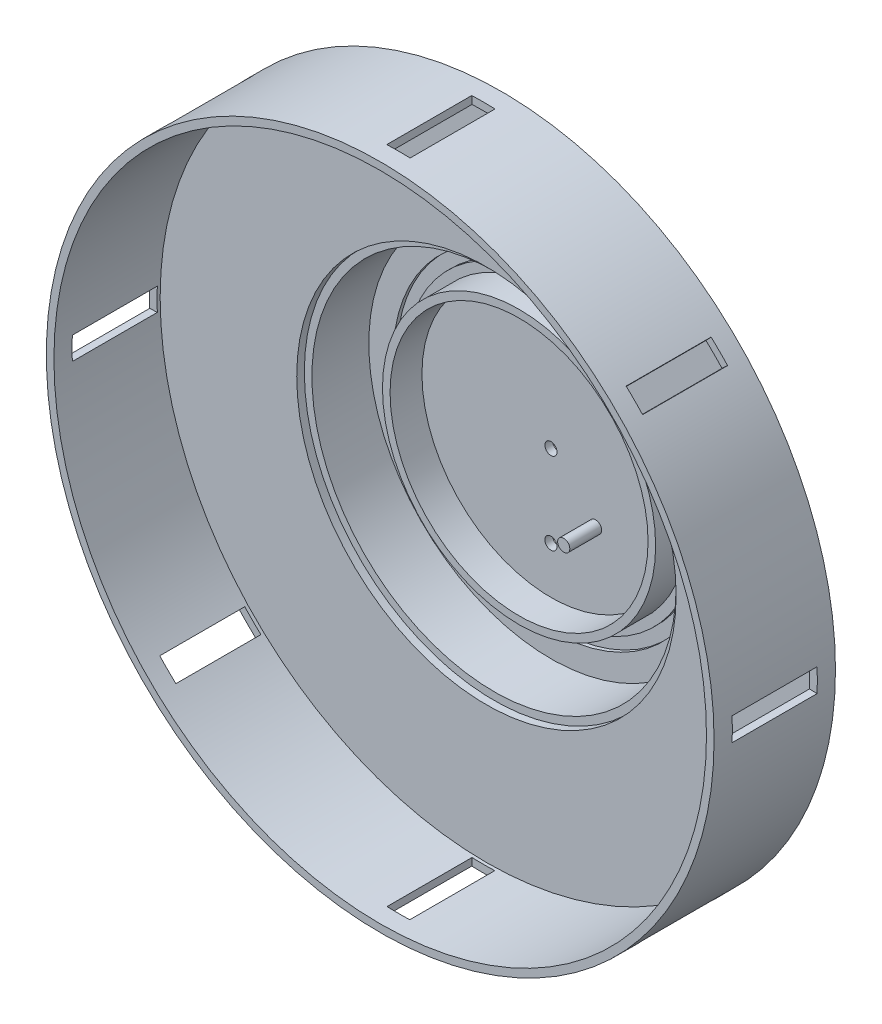
from build123d import *

# Parameters (mm, degrees)
BOSS_EXTRUDE1_DEPTH      = 1.25
BOSS_EXTRUDE1_DEPTH_BACK = 1.25
SKETCH1_R                = 60
SKETCH1_R_2              = 45
SKETCH1_R_3              = 42.5
SKETCH1_R_4              = 2
SKETCH1_3_R              = 45
SKETCH1_3_R_2            = 42.5
SKETCH1_3_R_3            = 2
BOSS_EXTRUDE2_DEPTH      = 11.75
BOSS_EXTRUDE3_DEPTH      = 20
BOSS_EXTRUDE3_DEPTH_BACK = 1.25
SKETCH1_4_R              = 62.5
SKETCH1_4_R_2            = 60
BOSS_EXTRUDE4_START      = -1.25
BOSS_EXTRUDE4_DEPTH      = 1.25
BOSS_EXTRUDE5_DEPTH      = 2.5
BOSS_EXTRUDE5_DEPTH_BACK = 2.5
SKETCH2_R                = 110
SKETCH2_R_2              = 107.5
SKETCH2_R_3              = 62.5
SKETCH3_R                = 110
SKETCH3_R_2              = 107.5
BOSS_EXTRUDE6_DEPTH      = 35
BOSS_EXTRUDE7_START      = 10
SKETCH5_R                = 60
SKETCH5_R_2              = 48
BOSS_EXTRUDE7_DEPTH      = 10
CUT_EXTRUDE1_DEPTH       = 167.287589735
FILLET1_R                = 1
CIRPATTERN2_COUNT        = 8
FILLET1_OF_CIRPATTERN2_R = 1
SKETCH7_R                = 57.5
CUT_EXTRUDE2_DEPTH       = 2.5
CUT_REVOLVE1_START       = 23.5
CUT_REVOLVE1_DEPTH       = 28
CIRPATTERN3_COUNT        = 8


# Read off the part's stored shape, not the designer's step: Cut-Revolve1
with BuildPart() as part:
    # Sketch1 → Boss-Extrude1 (new, two sides: drawn at the far end of the back side and taken through both)
    # profile 1 of 4: a face of its own
    with BuildSketch(Plane.XY.offset(-BOSS_EXTRUDE1_DEPTH_BACK)):
        Circle(SKETCH1_R)
        Circle(SKETCH1_R_2, mode=Mode.SUBTRACT)
        with BuildLine():
            ThreePointArc((-45.033320997, -26), (-42.301270189, -26.732050808), (-41.569219382, -24))
            ThreePointArc((-41.569219382, -24), (-46.364439662, 12.423314165), (-24, 41.569219382))
            ThreePointArc((-24, 41.569219382), (-23.267949192, 44.301270189), (-26, 45.033320997))
            ThreePointArc((-26, 45.033320997), (-50.228142967, 13.458590345), (-45.033320997, -26))
        make_face(mode=Mode.SUBTRACT)
        with BuildLine():
            ThreePointArc((45.033320997, -26), (44.301270189, -23.267949192), (41.569219382, -24))
            ThreePointArc((41.569219382, -24), (12.423314165, -46.364439662), (-24, -41.569219382))
            ThreePointArc((-24, -41.569219382), (-26.732050808, -42.301270189), (-26, -45.033320997))
            ThreePointArc((-26, -45.033320997), (13.458590345, -50.228142967), (45.033320997, -26))
        make_face(mode=Mode.SUBTRACT)
        with BuildLine():
            ThreePointArc((0, 52), (-2, 50), (0, 48))
            ThreePointArc((0, 48), (33.941125497, 33.941125497), (48, 0))
            ThreePointArc((48, 0), (50, -2), (52, 0))
            ThreePointArc((52, 0), (36.769552622, 36.769552622), (0, 52))
        make_face(mode=Mode.SUBTRACT)
    # profile 2 of 4: a face of its own
    with BuildSketch(Plane.XY.offset(-BOSS_EXTRUDE1_DEPTH_BACK)):
        Circle(SKETCH1_R_2)
        Circle(SKETCH1_R_3, mode=Mode.SUBTRACT)
    # profile 3 of 4: a face of its own
    with BuildSketch(Plane.XY.offset(-BOSS_EXTRUDE1_DEPTH_BACK)):
        Circle(SKETCH1_R_3)
        Circle(SKETCH1_R_4, mode=Mode.SUBTRACT)
        with Locations((14.715815051, -14.981481481)):
            Circle(SKETCH1_R_4, mode=Mode.SUBTRACT)
        with Locations((0, -27)):
            Circle(SKETCH1_R_4, mode=Mode.SUBTRACT)
    # profile 4 of 4: a face of its own
    with BuildSketch(Plane.XY.offset(-BOSS_EXTRUDE1_DEPTH_BACK)):
        with Locations((14.715815051, -14.981481481)):
            Circle(SKETCH1_R_4)
    extrude(amount=BOSS_EXTRUDE1_DEPTH + BOSS_EXTRUDE1_DEPTH_BACK)

    # Sketch1<3> → Boss-Extrude2 (add)
    # profile 1 of 2: a face of its own
    with BuildSketch(Plane.XY):
        Circle(SKETCH1_3_R)
        Circle(SKETCH1_3_R_2, mode=Mode.SUBTRACT)
    # profile 2 of 2: a face of its own
    with BuildSketch(Plane.XY):
        with Locations((14.715815051, -14.981481481)):
            Circle(SKETCH1_3_R_3)
    extrude(amount=BOSS_EXTRUDE2_DEPTH)

    # Sketch1<4> → Boss-Extrude3 (add, two sides: drawn at the far end of the back side and taken through both)
    with BuildSketch(Plane.XY.offset(-BOSS_EXTRUDE3_DEPTH_BACK)):
        Circle(SKETCH1_4_R)
        Circle(SKETCH1_4_R_2, mode=Mode.SUBTRACT)
    extrude(amount=BOSS_EXTRUDE3_DEPTH + BOSS_EXTRUDE3_DEPTH_BACK)

    # Sketch1<5> → Boss-Extrude4 (add)
    with BuildSketch(Plane.XY.offset(BOSS_EXTRUDE4_START)):
        with BuildLine():
            ThreePointArc((52, 0), (36.769552622, 36.769552622), (0, 52))
            ThreePointArc((0, 52), (-2, 50), (0, 48))
            ThreePointArc((0, 48), (33.941125497, 33.941125497), (48, 0))
            ThreePointArc((48, 0), (50, -2), (52, 0))
        make_face()
        with BuildLine():
            ThreePointArc((-26, 45.033320997), (-50.228142967, 13.458590345), (-45.033320997, -26))
            ThreePointArc((-45.033320997, -26), (-42.301270189, -26.732050808), (-41.569219382, -24))
            ThreePointArc((-41.569219382, -24), (-46.364439662, 12.423314165), (-24, 41.569219382))
            ThreePointArc((-24, 41.569219382), (-23.267949192, 44.301270189), (-26, 45.033320997))
        make_face()
        with BuildLine():
            ThreePointArc((-26, -45.033320997), (13.458590345, -50.228142967), (45.033320997, -26))
            ThreePointArc((45.033320997, -26), (44.301270189, -23.267949192), (41.569219382, -24))
            ThreePointArc((41.569219382, -24), (12.423314165, -46.364439662), (-24, -41.569219382))
            ThreePointArc((-24, -41.569219382), (-26.732050808, -42.301270189), (-26, -45.033320997))
        make_face()
    extrude(amount=BOSS_EXTRUDE4_DEPTH)

    # Sketch5 → Boss-Extrude7 (add)
    with BuildSketch(Plane(origin=(0, 0, -1.25), x_dir=(-1, 0, 0), z_dir=(0, 0, -1)).offset(BOSS_EXTRUDE7_START)):
        with Locations(Location((0, 0, 0), (0, 0, 180))):
            Circle(SKETCH5_R)
        Circle(SKETCH5_R_2, mode=Mode.SUBTRACT)
    extrude(amount=-BOSS_EXTRUDE7_DEPTH)

    # Sketch6 → Cut-Extrude1 (cut, through all)
    with BuildSketch(Plane(origin=(0, 0, -1.25), x_dir=(-1, 0, 0), z_dir=(0, 0, -1))):
        with BuildLine():
            Line((-48, 0), (-51.5, 0))
            ThreePointArc((-51.5, 0), (-52.173802074, 8.001391261), (-50.568057014, 15.868910193))
            Line((-50.568057014, 15.868910193), (-45.778413636, 14.433878376))
            ThreePointArc((-45.778413636, 14.433878376), (-47.441352502, 7.301922537), (-48, 0))
        make_face()
    cut_extrude1 = extrude(amount=CUT_EXTRUDE1_DEPTH, mode=Mode.SUBTRACT)

    # Fillet1
    fillet1_edges = [part.edges().sort_by_distance(p)[0] for p in [
        (50.568057014, 15.868910193, -6.25),
        (51.5, 0, -6.25),
    ]]
    fillet(fillet1_edges, radius=FILLET1_R)

    # CirPattern2: Cut-Extrude1 ×8 about axis
    cirpattern2_axis = Axis((0, 0, 0), (0, 0, 1))
    for i in range(1, CIRPATTERN2_COUNT):
        add(cut_extrude1.rotate(cirpattern2_axis, i * 360 / CIRPATTERN2_COUNT), mode=Mode.SUBTRACT)

    # Fillet1 of CirPattern2
    fillet1_of_cirpattern2_edges = [part.edges().sort_by_distance(p)[0] for p in [
        (24.536002018, 46.978030033, -6.25),
        (36.415999231, 36.415999231, -6.25),
        (-15.868910193, 50.568057014, -6.25),
        (0, 51.5, -6.25),
        (-46.978030033, 24.536002018, -6.25),
        (-36.415999231, 36.415999231, -6.25),
        (-50.568057014, -15.868910193, -6.25),
        (-51.5, 0, -6.25),
        (-24.536002018, -46.978030033, -6.25),
        (-36.415999231, -36.415999231, -6.25),
        (15.868910193, -50.568057014, -6.25),
        (0, -51.5, -6.25),
        (46.978030033, -24.536002018, -6.25),
        (36.415999231, -36.415999231, -6.25),
    ]]
    fillet(fillet1_of_cirpattern2_edges, radius=FILLET1_OF_CIRPATTERN2_R)

    # Sketch7 → Cut-Extrude2 (cut)
    with BuildSketch(Plane(origin=(0, 0, -11.25), x_dir=(-1, 0, 0), z_dir=(0, 0, -1))):
        Circle(SKETCH7_R)
    extrude(amount=-CUT_EXTRUDE2_DEPTH, mode=Mode.SUBTRACT)



with BuildPart() as body_2:
    # Sketch2 → Boss-Extrude5 (new, two sides: drawn at the far end of the back side and taken through both)
    # profile 1 of 2: a face of its own
    with BuildSketch(Plane.XY.offset(20).offset(-BOSS_EXTRUDE5_DEPTH_BACK)):
        Circle(SKETCH2_R)
        Circle(SKETCH2_R_2, mode=Mode.SUBTRACT)
    # profile 2 of 2: a face of its own
    with BuildSketch(Plane.XY.offset(20).offset(-BOSS_EXTRUDE5_DEPTH_BACK)):
        Circle(SKETCH2_R_2)
        Circle(SKETCH2_R_3, mode=Mode.SUBTRACT)
    extrude(amount=BOSS_EXTRUDE5_DEPTH + BOSS_EXTRUDE5_DEPTH_BACK)

    # Sketch3 → Boss-Extrude6 (add)
    with BuildSketch(Plane.XY.offset(22.5)):
        Circle(SKETCH3_R)
        Circle(SKETCH3_R_2, mode=Mode.SUBTRACT)
    extrude(amount=BOSS_EXTRUDE6_DEPTH)

    # Cut-Revolve1 outline → Cut-Revolve1 (cut)
    with BuildSketch(Plane.XY.offset(CUT_REVOLVE1_START)):
        with BuildLine():
            Line((-3.838944637, 109.932990972), (-3.751695896, 107.434513905))
            ThreePointArc((-3.751695896, 107.434513905), (0, 107.5), (3.751695896, 107.434513905))
            Line((3.751695896, 107.434513905), (3.838944637, 109.932990972))
            ThreePointArc((3.838944637, 109.932990972), (0, 110), (-3.838944637, 109.932990972))
        make_face()
    cut_revolve1 = extrude(amount=CUT_REVOLVE1_DEPTH, mode=Mode.SUBTRACT)

    # CirPattern3: Cut-Revolve1 ×8 about axis
    cirpattern3_axis = Axis((0, 0, 0), (0, 0, 1))
    for i in range(1, CIRPATTERN3_COUNT):
        add(cut_revolve1.rotate(cirpattern3_axis, i * 360 / CIRPATTERN3_COUNT), mode=Mode.SUBTRACT)


with BuildPart() as part_1:
    add(part.part)

    add(body_2.part)  # Revolve1 merges body 2
    # Sketch9 → Revolve1 (revolve)
    with BuildSketch(Plane(origin=(0, 0, 0), x_dir=(1, 0, 0), z_dir=(0, 1, 0))):
        Polygon((62.5, 1.25), (94.975952642, -17.5), (62.5, -17.5), align=None)
    revolve(axis=Axis((0, 0, 0), (0, 0, 1)))


solid = part_1.part
